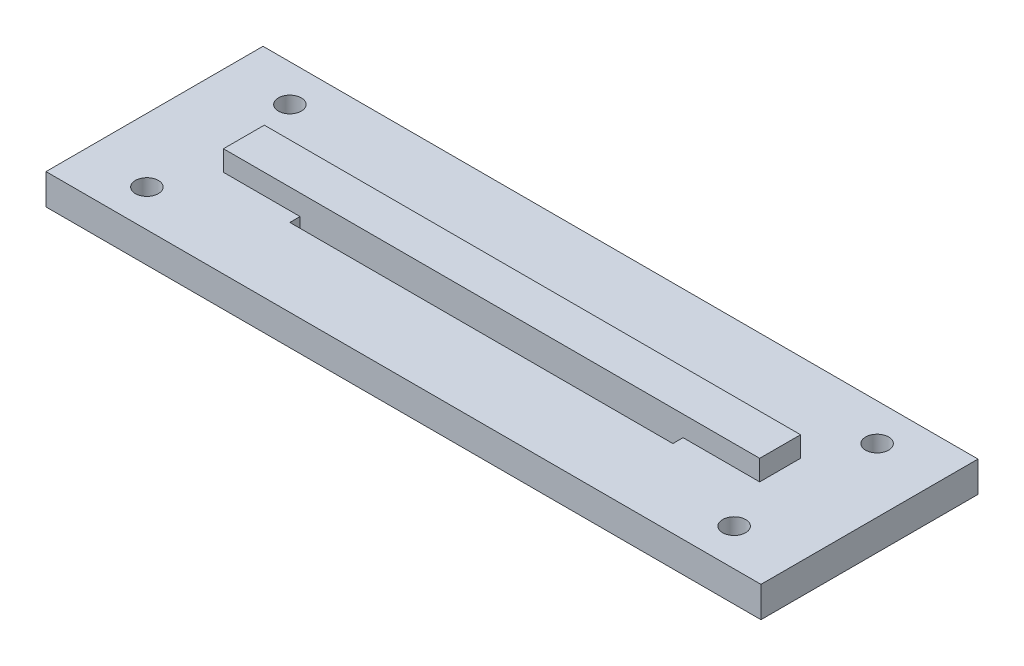
from build123d import *

# Parameters (mm, degrees)
F_01_BASE_PROFILE_W           = 280
F_01_BASE_PROFILE_H           = 85
F_01_BASE_PROFILE_R           = 4.5
F_01_BASE_PROFILE_W_2         = 150
F_01_BASE_PROFILE_H_2         = 24
F_01_BASE_EXTRUDE_DEPTH       = 12
F_02_BOSS_PROFILE_W           = 210
F_02_BOSS_PROFILE_H           = 16
F_02_REINFORCEMENT_BOSS_DEPTH = 20


with BuildPart() as part:
    # 01_Base_Profile → 01_Base_Extrude (new body)
    with BuildSketch(Plane(origin=(0, 0, 0), x_dir=(1, 0, 0), z_dir=(0, 1, 0))):
        Rectangle(F_01_BASE_PROFILE_W, F_01_BASE_PROFILE_H)
        with Locations((-115, -28)):
            Circle(F_01_BASE_PROFILE_R, mode=Mode.SUBTRACT)
        with Locations((115, -28)):
            Circle(F_01_BASE_PROFILE_R, mode=Mode.SUBTRACT)
        with Locations((-115, 28)):
            Circle(F_01_BASE_PROFILE_R, mode=Mode.SUBTRACT)
        with Locations((115, 28)):
            Circle(F_01_BASE_PROFILE_R, mode=Mode.SUBTRACT)
        Rectangle(F_01_BASE_PROFILE_W_2, F_01_BASE_PROFILE_H_2, mode=Mode.SUBTRACT)
    extrude(amount=F_01_BASE_EXTRUDE_DEPTH)

    # 02_Boss_Profile → 02_Reinforcement_Boss (add)
    with BuildSketch(Plane(origin=(0, 0, 0), x_dir=(1, 0, 0), z_dir=(0, 1, 0))):
        Rectangle(F_02_BOSS_PROFILE_W, F_02_BOSS_PROFILE_H)
    extrude(amount=F_02_REINFORCEMENT_BOSS_DEPTH)


solid = part.part
